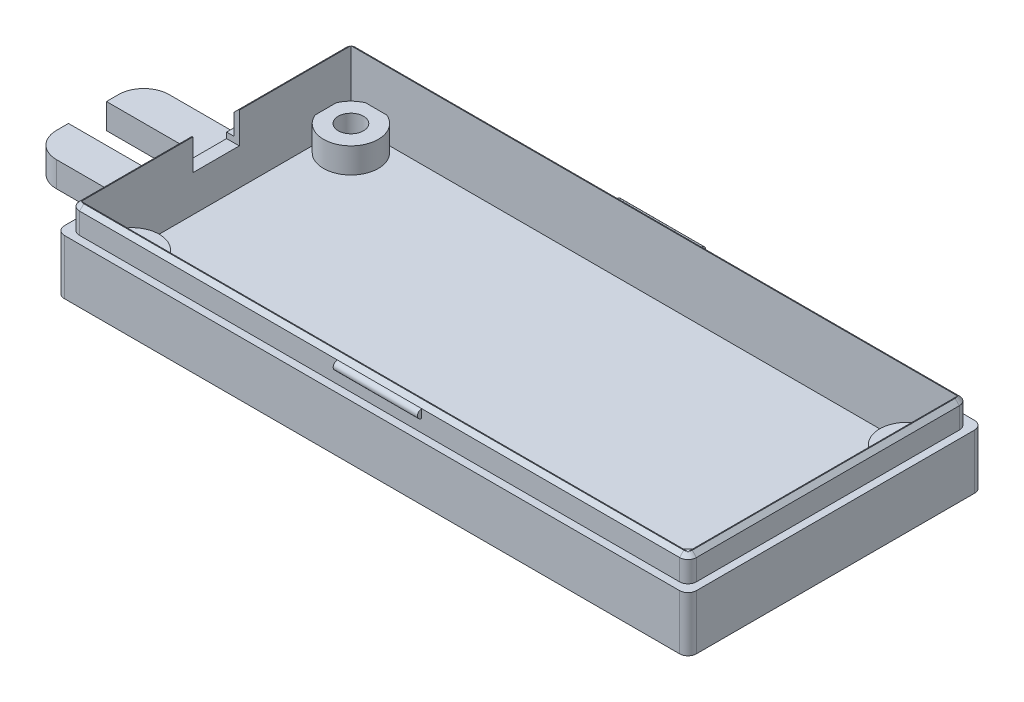
from build123d import *

# Parameters (mm, degrees)
SKETCH_6_W           = 75
SKETCH_6_H           = 35
SKETCH_6_W_2         = 72
SKETCH_6_H_2         = 32
EXTRUDE_2_DEPTH      = 5
SKETCH_7_W           = 75
SKETCH_7_H           = 35
EXTRUDE_3_DEPTH      = 1.5
FILLET_2_R           = 1
SKETCH_8_R           = 3.25
SKETCH_8_R_2         = 1.5
EXTRUDE_4_DEPTH      = 3
EXTRUDE_5_DEPTH      = 3
SKETCH_10_W          = 73.2
SKETCH_10_H          = 33.2
SKETCH_10_W_2        = 72
SKETCH_10_H_2        = 32
EXTRUDE_6_DEPTH      = 3
FILLET_5_R           = 1
SKETCH_11_W          = 5.5
SKETCH_11_H          = 7.368080292
CUT_EXTRUDE_1_DEPTH  = 60
EXTRUDE_7_DEPTH      = 5
EXTRUDE_7_DEPTH_BACK = 5
SKETCH_12_R          = 0.5
CHAMFER_1_SIZE       = 0.5


with BuildPart() as part:
    # Эскиз6 → Бобышка-Вытянуть2 (new body)
    with BuildSketch(Plane(origin=(0, 0, 0), x_dir=(1, 0, 0), z_dir=(0, 1, 0))):
        Rectangle(SKETCH_6_W, SKETCH_6_H)
        Rectangle(SKETCH_6_W_2, SKETCH_6_H_2, mode=Mode.SUBTRACT)
    extrude(amount=EXTRUDE_2_DEPTH)

    # Эскиз7 → Бобышка-Вытянуть3 (add)
    with BuildSketch(Plane.XZ):
        Rectangle(SKETCH_7_W, SKETCH_7_H)
    extrude(amount=EXTRUDE_3_DEPTH)

    # Скругление2
    fillet_2_edges = [part.edges().sort_by_distance(p)[0] for p in [
        (37.5, 1.75, 17.5),
        (-37.5, 1.75, 17.5),
        (-37.5, 1.75, -17.5),
        (37.5, 1.75, -17.5),
    ]]
    fillet(fillet_2_edges, radius=FILLET_2_R)

    # Эскиз8 → Бобышка-Вытянуть4 (add)
    # profile 1 of 4: a face of its own
    with BuildSketch(Plane(origin=(0, 0, 0), x_dir=(1, 0, 0), z_dir=(0, 1, 0))):
        with Locations((-33, 13)):
            Circle(SKETCH_8_R)
        with Locations(Location((-33, 13, 0), (0, 0, 270))):
            Circle(SKETCH_8_R_2, mode=Mode.SUBTRACT)
    # profile 2 of 4: a face of its own
    with BuildSketch(Plane(origin=(0, 0, 0), x_dir=(1, 0, 0), z_dir=(0, 1, 0))):
        with Locations((-33, -13)):
            Circle(SKETCH_8_R)
        with Locations(Location((-33, -13, 0), (0, 0, 90))):
            Circle(SKETCH_8_R_2, mode=Mode.SUBTRACT)
    # profile 3 of 4: a face of its own
    with BuildSketch(Plane(origin=(0, 0, 0), x_dir=(1, 0, 0), z_dir=(0, 1, 0))):
        with Locations((33, 13)):
            Circle(SKETCH_8_R)
        with Locations(Location((33, 13, 0), (0, 0, 90))):
            Circle(SKETCH_8_R_2, mode=Mode.SUBTRACT)
    # profile 4 of 4: a face of its own
    with BuildSketch(Plane(origin=(0, 0, 0), x_dir=(1, 0, 0), z_dir=(0, 1, 0))):
        with Locations((33, -13)):
            Circle(SKETCH_8_R)
        with Locations(Location((33, -13, 0), (0, 0, 270))):
            Circle(SKETCH_8_R_2, mode=Mode.SUBTRACT)
    extrude(amount=EXTRUDE_4_DEPTH)

    # Эскиз10 → Бобышка-Вытянуть6 (add)
    with BuildSketch(Plane(origin=(0, 5, 0), x_dir=(1, 0, 0), z_dir=(0, 1, 0))):
        Rectangle(SKETCH_10_W, SKETCH_10_H)
        Rectangle(SKETCH_10_W_2, SKETCH_10_H_2, mode=Mode.SUBTRACT)
    extrude(amount=EXTRUDE_6_DEPTH)

    # Скругление5
    fillet_5_edges = [part.edges().sort_by_distance(p)[0] for p in [
        (-36.6, 6.5, -16.6),
        (-36.6, 6.5, 16.6),
        (36.6, 6.5, 16.6),
        (36.6, 6.5, -16.6),
    ]]
    fillet(fillet_5_edges, radius=FILLET_5_R)

    # Эскиз11 → Вырез-Вытянуть1 (cut)
    with BuildSketch(Plane(origin=(0, 0, 0), x_dir=(0, 0, -1), z_dir=(1, 0, 0))):
        with Locations((0, 8.00848738)):
            Rectangle(SKETCH_11_W, SKETCH_11_H)
    extrude(amount=-CUT_EXTRUDE_1_DEPTH, mode=Mode.SUBTRACT)

    # Эскиз12 → Бобышка-Вытянуть7 (add, two sides: drawn at the far end of the back side and taken through both)
    with BuildSketch(Plane(origin=(0, 0, 0), x_dir=(0, 0, -1), z_dir=(1, 0, 0)).offset(-EXTRUDE_7_DEPTH_BACK)):
        with Locations((-16.6, 7)):
            Circle(SKETCH_12_R)
        with Locations((16.6, 7)):
            Circle(SKETCH_12_R)
    extrude(amount=EXTRUDE_7_DEPTH + EXTRUDE_7_DEPTH_BACK)

    # Фаска1
    # the kernel refuses this chamfer: 0.5 mm, written as the material it takes off along each edge
    with BuildSketch(Plane(origin=(36.6, 8, -15.6), x_dir=(-0.9996219169112968, 0.02749587661058574, 0), z_dir=(0, 0, 1))) as chamfer_1_piece_1:
        Polygon((CHAMFER_1_SIZE * 0.999621916911, CHAMFER_1_SIZE * 0.0274958766106), (-CHAMFER_1_SIZE * 0.0274958766106, CHAMFER_1_SIZE * 0.999621916911), (0, 0), align=None)
    extrude(amount=31.2, mode=Mode.SUBTRACT)
    with BuildSketch(Plane(origin=(35.6, 8, 16.6), x_dir=(0, 0.02749587661058555, -0.9996219169112968), z_dir=(-1, 0, 0))) as chamfer_1_piece_2_section:
        Polygon((CHAMFER_1_SIZE * 0.999621916911, CHAMFER_1_SIZE * 0.0274958766106), (-CHAMFER_1_SIZE * 0.0274958766106, CHAMFER_1_SIZE * 0.999621916911), (0, 0), align=None)
    chamfer_1_piece_2 = extrude(amount=71.2, mode=Mode.PRIVATE)
    chamfer_1_piece_2 = split(chamfer_1_piece_2, bisect_by=Plane(origin=(5, 7.835672891, 16.434803325), z_dir=(1, 0, 0)), keep=Keep.TOP, mode=Mode.PRIVATE)
    chamfer_1_piece_2 = chamfer_1_piece_2 - Plane(origin=(20.3, 7, 16.6), x_dir=(0, 0, -1), z_dir=(-1, 0, 0)) * Cylinder(0.5, 145, mode=Mode.PRIVATE)
    add(chamfer_1_piece_2, mode=Mode.SUBTRACT)
    with BuildSketch(Plane(origin=(35.6, 8, 16.6), x_dir=(0, 0.02749587661058555, -0.9996219169112968), z_dir=(-1, 0, 0))) as chamfer_1_piece_3_section:
        Polygon((CHAMFER_1_SIZE * 0.999621916911, CHAMFER_1_SIZE * 0.0274958766106), (-CHAMFER_1_SIZE * 0.0274958766106, CHAMFER_1_SIZE * 0.999621916911), (0, 0), align=None)
    chamfer_1_piece_3 = extrude(amount=71.2, mode=Mode.PRIVATE)
    chamfer_1_piece_3 = split(chamfer_1_piece_3, bisect_by=Plane(origin=(5, 7.835672891, 16.434803325), z_dir=(-1, 0, 0)), keep=Keep.TOP, mode=Mode.PRIVATE)
    chamfer_1_piece_3 = split(chamfer_1_piece_3, bisect_by=Plane(origin=(-5, 7.835672891, 16.434803325), z_dir=(1, 0, 0)), keep=Keep.TOP, mode=Mode.PRIVATE)
    chamfer_1_piece_3 = chamfer_1_piece_3 - Plane(origin=(0, 7, 16.6), x_dir=(0, 0, -1), z_dir=(-1, 0, 0)) * Cylinder(0.5, 145, mode=Mode.PRIVATE)
    add(chamfer_1_piece_3, mode=Mode.SUBTRACT)
    with BuildSketch(Plane(origin=(35.6, 8, 16.6), x_dir=(0, 0.02749587661058555, -0.9996219169112968), z_dir=(-1, 0, 0))) as chamfer_1_piece_4_section:
        Polygon((CHAMFER_1_SIZE * 0.999621916911, CHAMFER_1_SIZE * 0.0274958766106), (-CHAMFER_1_SIZE * 0.0274958766106, CHAMFER_1_SIZE * 0.999621916911), (0, 0), align=None)
    chamfer_1_piece_4 = extrude(amount=71.2, mode=Mode.PRIVATE)
    chamfer_1_piece_4 = split(chamfer_1_piece_4, bisect_by=Plane(origin=(-5, 7.835672891, 16.434803325), z_dir=(-1, 0, 0)), keep=Keep.TOP, mode=Mode.PRIVATE)
    chamfer_1_piece_4 = chamfer_1_piece_4 - Plane(origin=(-20.3, 7, 16.6), x_dir=(0, 0, -1), z_dir=(-1, 0, 0)) * Cylinder(0.5, 145, mode=Mode.PRIVATE)
    add(chamfer_1_piece_4, mode=Mode.SUBTRACT)
    with BuildSketch(Plane(origin=(-36.6, 8, -1.464158506), x_dir=(0.9996219169112968, 0.02749587661058574, 0), z_dir=(0, 0, -1)), Plane(origin=(-36.6, 8, 15.6), x_dir=(0.9996219169112968, 0.02749587661058574, 0), z_dir=(0, 0, -1))) as chamfer_1_piece_5:
        Polygon((CHAMFER_1_SIZE * 0.999621916911, CHAMFER_1_SIZE * 0.0274958766106), (-CHAMFER_1_SIZE * 0.0274958766106, CHAMFER_1_SIZE * 0.999621916911), (0, 0), align=None)
    extrude(amount=14.135841494, mode=Mode.SUBTRACT)
    with BuildSketch(Plane(origin=(-35.6, 8, -16.6), x_dir=(0, 0.02749587661058555, 0.9996219169112968), z_dir=(1, 0, 0))) as chamfer_1_piece_6_section:
        Polygon((CHAMFER_1_SIZE * 0.999621916911, CHAMFER_1_SIZE * 0.0274958766106), (-CHAMFER_1_SIZE * 0.0274958766106, CHAMFER_1_SIZE * 0.999621916911), (0, 0), align=None)
    chamfer_1_piece_6 = extrude(amount=71.2, mode=Mode.PRIVATE)
    chamfer_1_piece_6 = chamfer_1_piece_6 - Plane(origin=(-20.3, 7, -16.6), x_dir=(0, 0, -1), z_dir=(-1, 0, 0)) * Cylinder(0.5, 145, mode=Mode.PRIVATE)
    chamfer_1_piece_6 = split(chamfer_1_piece_6, bisect_by=Plane(origin=(-5, 7.835672891, -16.434803325), z_dir=(-1, 0, 0)), keep=Keep.TOP, mode=Mode.PRIVATE)
    add(chamfer_1_piece_6, mode=Mode.SUBTRACT)
    with BuildSketch(Plane(origin=(-35.6, 8, -16.6), x_dir=(0, 0.02749587661058555, 0.9996219169112968), z_dir=(1, 0, 0))) as chamfer_1_piece_7_section:
        Polygon((CHAMFER_1_SIZE * 0.999621916911, CHAMFER_1_SIZE * 0.0274958766106), (-CHAMFER_1_SIZE * 0.0274958766106, CHAMFER_1_SIZE * 0.999621916911), (0, 0), align=None)
    chamfer_1_piece_7 = extrude(amount=71.2, mode=Mode.PRIVATE)
    chamfer_1_piece_7 = split(chamfer_1_piece_7, bisect_by=Plane(origin=(5, 7.835672891, -16.434803325), z_dir=(-1, 0, 0)), keep=Keep.TOP, mode=Mode.PRIVATE)
    chamfer_1_piece_7 = chamfer_1_piece_7 - Plane(origin=(0, 7, -16.6), x_dir=(0, 0, -1), z_dir=(-1, 0, 0)) * Cylinder(0.5, 145, mode=Mode.PRIVATE)
    chamfer_1_piece_7 = split(chamfer_1_piece_7, bisect_by=Plane(origin=(-5, 7.835672891, -16.434803325), z_dir=(1, 0, 0)), keep=Keep.TOP, mode=Mode.PRIVATE)
    add(chamfer_1_piece_7, mode=Mode.SUBTRACT)
    with BuildSketch(Plane(origin=(-35.6, 8, -16.6), x_dir=(0, 0.02749587661058555, 0.9996219169112968), z_dir=(1, 0, 0))) as chamfer_1_piece_8_section:
        Polygon((CHAMFER_1_SIZE * 0.999621916911, CHAMFER_1_SIZE * 0.0274958766106), (-CHAMFER_1_SIZE * 0.0274958766106, CHAMFER_1_SIZE * 0.999621916911), (0, 0), align=None)
    chamfer_1_piece_8 = extrude(amount=71.2, mode=Mode.PRIVATE)
    chamfer_1_piece_8 = split(chamfer_1_piece_8, bisect_by=Plane(origin=(5, 7.835672891, -16.434803325), z_dir=(1, 0, 0)), keep=Keep.TOP, mode=Mode.PRIVATE)
    chamfer_1_piece_8 = chamfer_1_piece_8 - Plane(origin=(20.3, 7, -16.6), x_dir=(0, 0, -1), z_dir=(-1, 0, 0)) * Cylinder(0.5, 145, mode=Mode.PRIVATE)
    add(chamfer_1_piece_8, mode=Mode.SUBTRACT)
    with BuildSketch(Plane(origin=(-35.6, 8, -15.6), x_dir=(-1, 0, 0), z_dir=(0, 0, 1))) as chamfer_1_piece_9:
        Polygon((1, CHAMFER_1_SIZE), (1 - CHAMFER_1_SIZE, 0), (1, 0), align=None)
    revolve(axis=Axis((-35.6, 8, -15.6), (0, -1, 0)), revolution_arc=90, mode=Mode.SUBTRACT)
    with BuildSketch(Plane(origin=(-35.6, 8, 15.6), x_dir=(-1, 0, 0), z_dir=(0, 0, -1))) as chamfer_1_piece_10:
        Polygon((1 - CHAMFER_1_SIZE, 0), (1, -CHAMFER_1_SIZE), (1, 0), align=None)
    revolve(axis=Axis((-35.6, 8, 15.6), (0, 1, 0)), revolution_arc=90, mode=Mode.SUBTRACT)
    with BuildSketch(Plane(origin=(35.6, 8, -15.6), x_dir=(1, 0, 0), z_dir=(0, 0, 1))) as chamfer_1_piece_11:
        Polygon((1 - CHAMFER_1_SIZE, 0), (1, -CHAMFER_1_SIZE), (1, 0), align=None)
    revolve(axis=Axis((35.6, 8, -15.6), (0, 1, 0)), revolution_arc=90, mode=Mode.SUBTRACT)
    with BuildSketch(Plane(origin=(35.6, 8, 15.6), x_dir=(0, 0, 1), z_dir=(-1, 0, 0))) as chamfer_1_piece_12:
        Polygon((1 - CHAMFER_1_SIZE, 0), (1, -CHAMFER_1_SIZE), (1, 0), align=None)
    revolve(axis=Axis((35.6, 8, 15.6), (0, 1, 0)), revolution_arc=90, mode=Mode.SUBTRACT)


with BuildPart() as body_2:
    # Эскиз9 → Бобышка-Вытянуть5 (new body)
    with BuildSketch(Plane.XZ.offset(1.5)):
        with BuildLine():
            Line((-36.264314741, -6.691050367), (-36.264314741, 0))
            Line((-36.264314741, 0), (-36.266484017, 6.682359232))
            Line((-36.266484017, 6.682359232), (-48.264314741, 6.682359232))
            ThreePointArc((-48.264314741, 6.682359232), (-50.385635084, 5.803679576), (-51.264314741, 3.682359232))
            Line((-51.264314741, 3.682359232), (-51.264314741, 2.250473493))
            Line((-51.264314741, 2.250473493), (-41.905662099, 2.250473493))
            ThreePointArc((-41.905662099, 2.250473493), (-40.491448537, 1.664687055), (-39.905662099, 0.250473493))
            Line((-39.905662099, 0.250473493), (-39.905662099, -0.259164628))
            ThreePointArc((-39.905662099, -0.259164628), (-40.491448537, -1.67337819), (-41.905662099, -2.259164628))
            Line((-41.905662099, -2.259164628), (-51.264314741, -2.259164628))
            Line((-51.264314741, -2.259164628), (-51.264314741, -3.691050367))
            ThreePointArc((-51.264314741, -3.691050367), (-50.385635084, -5.812370711), (-48.264314741, -6.691050367))
            Line((-48.264314741, -6.691050367), (-36.264314741, -6.691050367))
        make_face()
    extrude(amount=-EXTRUDE_5_DEPTH)


solid = Compound([part.part, body_2.part])
